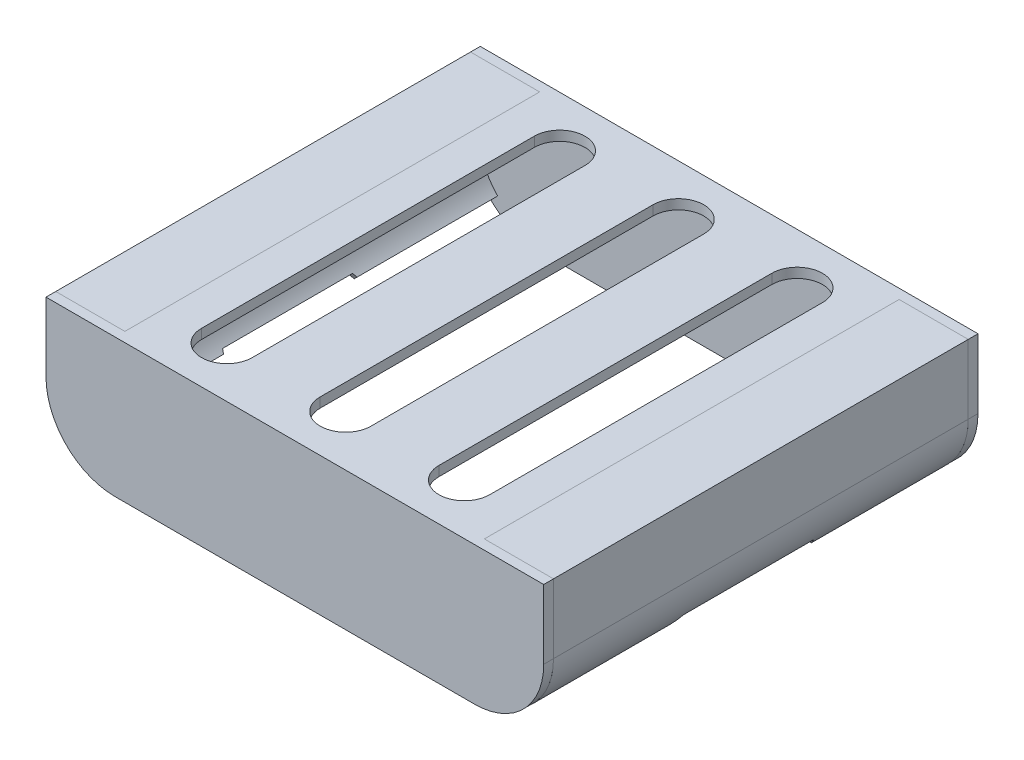
from build123d import *

# Parameters (mm, degrees)
BOSS_EXTRUDE1_START     = -54.757068412
BOSS_EXTRUDE1_OUTLINE_W = 56.134
BOSS_EXTRUDE1_OUTLINE_H = 1.524
BOSS_EXTRUDE1_DEPTH     = 63.5
BOSS_EXTRUDE1_START_2   = -3.957068512
BOSS_EXTRUDE1_2_DEPTH   = 12.7000001
BOSS_EXTRUDE1_3_DEPTH   = 12.7
BOSS_EXTRUDE1_START_3   = 4
BOSS_EXTRUDE1_4_DEPTH   = 8
BOSS_EXTRUDE2_START     = 0.635
BOSS_EXTRUDE2_DEPTH     = 0.635
BOSS_EXTRUDE3_START     = 1.524
BOSS_EXTRUDE3_DEPTH     = 1.524
CUT_EXTRUDE1_DEPTH      = 20.32
BOSS_EXTRUDE4_DEPTH     = 0.635
BOSS_EXTRUDE5_DEPTH     = 1.524
CUT_EXTRUDE2_DEPTH      = 97.141013189
CUT_EXTRUDE3_DEPTH      = 97.141013189
CUT_EXTRUDE4_DEPTH      = 97.470607757
DRAFT1_ANGLE            = 30
BOSS_EXTRUDE10_DEPTH    = 64.77
BOSS_EXTRUDE10_2_DEPTH  = 64.77
CUT_EXTRUDE6_DEPTH      = 95.655903969
CUT_EXTRUDE6_DEPTH_BACK = 95.655903969


with BuildPart() as part:
    # Boss-Extrude1: read off the stored shape, not the designer's step
    # Boss-Extrude1 outline → Boss-Extrude1 (new body)
    with BuildSketch(Plane.XY.offset(-9.377931588).offset(BOSS_EXTRUDE1_START)):
        with BuildLine():
            Line((9.525, 0.127), (11.049, 0.127))
            ThreePointArc((11.049, 0.127), (10.305871492, 4.062975673), (8.178799999, 7.457045699))
            Line((8.178799999, 7.457045699), (8.1788, 4.93833931))
            ThreePointArc((8.1788, 4.93833931), (9.182109033, 2.625061268), (9.525, 0.127))
        make_face()
        with Locations((-27.813, 10.16)):
            Rectangle(BOSS_EXTRUDE1_OUTLINE_W, BOSS_EXTRUDE1_OUTLINE_H)
        with BuildLine():
            Line((-63.8048, 4.93833931), (-63.8048, 7.4570457))
            ThreePointArc((-63.8048, 7.4570457), (-65.931871492, 4.062975673), (-66.675, 0.127))
            Line((-66.675, 0.127), (-65.151, 0.127))
            ThreePointArc((-65.151, 0.127), (-64.808109033, 2.625061268), (-63.8048, 4.93833931))
        make_face()
    extrude(amount=BOSS_EXTRUDE1_DEPTH)

    # Boss-Extrude1 2 outline → Boss-Extrude1 2 (add)
    with BuildSketch(Plane.XY.offset(-9.377931588).offset(BOSS_EXTRUDE1_START_2)):
        with BuildLine():
            Line((8.1788, 4.93833931), (8.178799999, 7.457045699))
            ThreePointArc((8.178799999, 7.457045699), (4.578589667, 10.017902345), (0.253996203, 10.922))
            Line((0.253996203, 10.922), (0.253997015, 9.398))
            ThreePointArc((0.253997015, 9.398), (4.800729077, 8.206523235), (8.1788, 4.93833931))
        make_face()
        with BuildLine():
            Line((-55.879996083, 9.398), (-55.87999707, 10.922))
            ThreePointArc((-55.87999707, 10.922), (-60.204590064, 10.017902172), (-63.8048, 7.4570457))
            Line((-63.8048, 7.4570457), (-63.8048, 4.93833931))
            ThreePointArc((-63.8048, 4.93833931), (-60.426728671, 8.206523463), (-55.879996083, 9.398))
        make_face()
    extrude(amount=BOSS_EXTRUDE1_2_DEPTH)

    # Boss-Extrude1 3 outline → Boss-Extrude1 3 (add)
    with BuildSketch(Plane.XY.offset(-9.377931588).offset(BOSS_EXTRUDE1_START)):
        with BuildLine():
            Line((8.1788, 4.93833931), (8.178799999, 7.457045699))
            ThreePointArc((8.178799999, 7.457045699), (4.578589667, 10.017902345), (0.253996203, 10.922))
            Line((0.253996203, 10.922), (0.253997015, 9.398))
            ThreePointArc((0.253997015, 9.398), (4.800729077, 8.206523235), (8.1788, 4.93833931))
        make_face()
        with BuildLine():
            Line((-55.879996083, 9.398), (-55.87999707, 10.922))
            ThreePointArc((-55.87999707, 10.922), (-60.204590064, 10.017902172), (-63.8048, 7.4570457))
            Line((-63.8048, 7.4570457), (-63.8048, 4.93833931))
            ThreePointArc((-63.8048, 4.93833931), (-60.426728671, 8.206523463), (-55.879996083, 9.398))
        make_face()
    extrude(amount=BOSS_EXTRUDE1_3_DEPTH)

    # Boss-Extrude1 4 outline → Boss-Extrude1 4 (cut)
    with BuildSketch(Plane(origin=(0, 0, 0), x_dir=(1, 0, 0), z_dir=(0, 1, 0)).offset(BOSS_EXTRUDE1_START_3)):
        with BuildLine():
            Line((4.010916814, 9.377931588), (4.421879489, 9.377931396))
            ThreePointArc((4.421879489, 9.377931396), (7.089969704, 10.606775135), (8.1788, 13.335))
            Line((8.1788, 13.335), (0.254, 13.335))
            ThreePointArc((0.254, 13.335), (1.342829022, 10.606776477), (4.010916814, 9.377931588))
        make_face()
        with BuildLine():
            Line((-60.047883129, 9.377931585), (-59.636916814, 9.377931588))
            ThreePointArc((-59.636916814, 9.377931588), (-56.968829022, 10.606776477), (-55.88, 13.335))
            Line((-55.88, 13.335), (-63.8048, 13.335))
            ThreePointArc((-63.8048, 13.335), (-62.715970959, 10.606776456), (-60.047883129, 9.377931585))
        make_face()
        with BuildLine():
            Line((0.254, 51.435), (8.1788, 51.435))
            ThreePointArc((8.1788, 51.435), (4.2164, 55.3974), (0.254, 51.435))
        make_face()
        with BuildLine():
            Line((-63.8048, 51.435), (-55.88, 51.435))
            ThreePointArc((-55.88, 51.435), (-59.8424, 55.3974), (-63.8048, 51.435))
        make_face()
    extrude(amount=BOSS_EXTRUDE1_4_DEPTH, mode=Mode.SUBTRACT)

    # Sketch2 → Boss-Extrude2 (add)
    with BuildSketch(Plane(origin=(0, 0, -64.135), x_dir=(-1, 0, 0), z_dir=(0, 0, -1)).offset(BOSS_EXTRUDE2_START)):
        with BuildLine():
            Line((-0.254, 10.922), (55.88, 10.922))
            ThreePointArc((55.88, 10.922), (59.875408752, 10.155396377), (63.303352044, 7.964465753))
            ThreePointArc((63.303352044, 7.964465753), (63.779199771, 6.836644565), (63.27193426, 5.722600852))
            ThreePointArc((63.27193426, 5.722600852), (60.007627981, 8.428453382), (55.88, 9.398))
            Line((55.88, 9.398), (-0.254, 9.398))
            ThreePointArc((-0.254, 9.398), (-4.381627981, 8.428453382), (-7.64593426, 5.722600852))
            ThreePointArc((-7.64593426, 5.722600852), (-8.153199771, 6.836644565), (-7.677352044, 7.964465753))
            ThreePointArc((-7.677352044, 7.964465753), (-4.249408752, 10.155396377), (-0.254, 10.922))
        make_face()
    extrude(amount=-BOSS_EXTRUDE2_DEPTH)

    # Sketch3 → Boss-Extrude3 (add)
    with BuildSketch(Plane(origin=(0, 0, -64.77), x_dir=(-1, 0, 0), z_dir=(0, 0, -1)).offset(BOSS_EXTRUDE3_START)):
        with BuildLine():
            Line((-0.254, 10.922), (55.88, 10.922))
            Line((55.88, 10.922), (66.675, 10.922))
            Line((66.675, 10.922), (66.675, 0.127))
            ThreePointArc((66.675, 0.127), (63.513217703, -7.506217703), (55.88, -10.668))
            Line((55.88, -10.668), (-0.254, -10.668))
            ThreePointArc((-0.254, -10.668), (-7.887217703, -7.506217703), (-11.049, 0.127))
            Line((-11.049, 0.127), (-11.049, 10.922))
            Line((-11.049, 10.922), (-0.254, 10.922))
        make_face()
    extrude(amount=-BOSS_EXTRUDE3_DEPTH)

    # Sketch4 → Cut-Extrude1 (cut)
    with BuildSketch(Plane(origin=(0, 0, -42.545), x_dir=(-1, 0, 0), z_dir=(0, 0, -1))):
        with BuildLine():
            Line((-9.398881902, 1.651), (-10.940882099, 1.651))
            ThreePointArc((-10.940882099, 1.651), (-11.0219366, 0.890915159), (-11.049, 0.127))
            Line((-11.049, 0.127), (-9.525, 0.127))
            ThreePointArc((-9.525, 0.127), (-9.493416678, 0.891604763), (-9.398881902, 1.651))
        make_face()
    extrude(amount=-CUT_EXTRUDE1_DEPTH, mode=Mode.SUBTRACT)

    # Sketch5 → Boss-Extrude4 (add)
    with BuildSketch(Plane.XY.offset(-0.635)):
        with BuildLine():
            Line((0.254, 9.398), (-55.88, 9.398))
            ThreePointArc((-55.88, 9.398), (-60.007627981, 8.428453382), (-63.27193426, 5.722600852))
            ThreePointArc((-63.27193426, 5.722600852), (-63.779199771, 6.836644565), (-63.303352044, 7.964465753))
            ThreePointArc((-63.303352044, 7.964465753), (-59.875408752, 10.155396377), (-55.88, 10.922))
            Line((-55.88, 10.922), (0.254, 10.922))
            ThreePointArc((0.254, 10.922), (4.249408752, 10.155396377), (7.677352044, 7.964465753))
            ThreePointArc((7.677352044, 7.964465753), (8.153199771, 6.836644565), (7.64593426, 5.722600852))
            ThreePointArc((7.64593426, 5.722600852), (4.381627981, 8.428453382), (0.254, 9.398))
        make_face()
    extrude(amount=BOSS_EXTRUDE4_DEPTH)

    # Sketch6 → Boss-Extrude5 (add)
    with BuildSketch(Plane.XY):
        with BuildLine():
            Line((-55.88, 10.922), (0.254, 10.922))
            Line((0.254, 10.922), (11.049, 10.922))
            Line((11.049, 10.922), (11.049, 0.127))
            ThreePointArc((11.049, 0.127), (7.887217703, -7.506217703), (0.254, -10.668))
            Line((0.254, -10.668), (-55.88, -10.668))
            ThreePointArc((-55.88, -10.668), (-63.513217703, -7.506217703), (-66.675, 0.127))
            Line((-66.675, 0.127), (-66.675, 10.922))
            Line((-66.675, 10.922), (-55.88, 10.922))
        make_face()
    extrude(amount=BOSS_EXTRUDE5_DEPTH)

    # Sketch8 → Cut-Extrude2 (cut, through all)
    with BuildSketch(Plane.XZ.offset(-9.398)):
        with BuildLine():
            Line((-5.3086, -58.3692), (-5.3086, -6.4008))
            ThreePointArc((-5.3086, -6.4008), (-9.271, -2.4384), (-13.2334, -6.4008))
            Line((-13.2334, -6.4008), (-13.2334, -58.3692))
            ThreePointArc((-13.2334, -58.3692), (-9.271, -62.3316), (-5.3086, -58.3692))
        make_face()
    extrude(amount=-CUT_EXTRUDE2_DEPTH, mode=Mode.SUBTRACT)

    # Sketch9 → Cut-Extrude3 (cut, through all)
    with BuildSketch(Plane.XZ.offset(-9.398)):
        with BuildLine():
            Line((-42.3926, -58.3692), (-42.3926, -6.4008))
            ThreePointArc((-42.3926, -6.4008), (-46.355, -2.4384), (-50.3174, -6.4008))
            Line((-50.3174, -6.4008), (-50.3174, -58.3692))
            ThreePointArc((-50.3174, -58.3692), (-46.355, -62.3316), (-42.3926, -58.3692))
        make_face()
    extrude(amount=-CUT_EXTRUDE3_DEPTH, mode=Mode.SUBTRACT)

    # Sketch10 → Cut-Extrude4 (cut, through all)
    with BuildSketch(Plane(origin=(0, 10.922, 0), x_dir=(-1, 0, 0), z_dir=(0, 1, 0))):
        with BuildLine():
            Line((31.7754, -58.3692), (31.7754, -6.4008))
            ThreePointArc((31.7754, -6.4008), (27.813, -2.4384), (23.8506, -6.4008))
            Line((23.8506, -6.4008), (23.8506, -58.3692))
            ThreePointArc((23.8506, -58.3692), (27.813, -62.3316), (31.7754, -58.3692))
        make_face()
    extrude(amount=-CUT_EXTRUDE4_DEPTH, mode=Mode.SUBTRACT)

    # Draft1
    draft1_faces = [part.faces().sort_by_distance(p)[0] for p in [
        (10.247932379, 0.89048884, -22.225),
        (10.247932379, 0.89048884, -42.545),
    ]]
    draft(draft1_faces, Plane(origin=(9.398881902, 1.651, -22.225), x_dir=(0, 0, -1), z_dir=(0, -1, 0)), DRAFT1_ANGLE)


with BuildPart() as body_2:
    # Sketch15 → Boss-Extrude10 (new body)
    with BuildSketch(Plane.XY.offset(-64.77)):
        with BuildLine():
            Line((-63.513217703, -7.506217703), (-62.435586968, -6.428586968))
            ThreePointArc((-62.435586968, -6.428586968), (-65.129117713, -0.509602336), (-63.27193426, 5.722600852))
            ThreePointArc((-63.27193426, 5.722600852), (-63.779199771, 6.836644565), (-63.303352044, 7.964465753))
            ThreePointArc((-63.303352044, 7.964465753), (-59.875408752, 10.155396377), (-55.88, 10.922))
            Line((-55.88, 10.922), (-66.675, 10.922))
            Line((-66.675, 10.922), (-66.675, 0.127))
            ThreePointArc((-66.675, 0.127), (-65.853279553, -4.004067652), (-63.513217703, -7.506217703))
        make_face()
    extrude(amount=BOSS_EXTRUDE10_DEPTH)


with BuildPart() as body_3:
    # Sketch15 → Boss-Extrude10 2 (new body)
    with BuildSketch(Plane.XY.offset(-64.77)):
        with BuildLine():
            Line((6.809586968, -6.428586968), (7.887217703, -7.506217703))
            ThreePointArc((7.887217703, -7.506217703), (10.227279553, -4.004067652), (11.049, 0.127))
            Line((11.049, 0.127), (11.049, 10.922))
            Line((11.049, 10.922), (0.254, 10.922))
            ThreePointArc((0.254, 10.922), (4.249408752, 10.155396377), (7.677352044, 7.964465753))
            ThreePointArc((7.677352044, 7.964465753), (8.153199771, 6.836644565), (7.64593426, 5.722600852))
            ThreePointArc((7.64593426, 5.722600852), (9.503117713, -0.509602336), (6.809586968, -6.428586968))
        make_face()
    extrude(amount=BOSS_EXTRUDE10_2_DEPTH)


with BuildPart() as cut_extrude6_tool:
    # Sketch16 → Cut-Extrude6 (new, two sides: drawn at the far end of the back side and taken through both)
    with BuildSketch(Plane(origin=(0, 0, 0), x_dir=(0, 0, -1), z_dir=(1, 0, 0)).offset(-CUT_EXTRUDE6_DEPTH_BACK)):
        Polygon((21.34627289, -7.506217703), (43.42372711, -7.506217703), (42.545, -5.984217703), (22.225, -5.984217703), align=None)
    extrude(amount=CUT_EXTRUDE6_DEPTH + CUT_EXTRUDE6_DEPTH_BACK)


with BuildPart() as body_2_1:
    add(body_2.part)

    # Cut-Extrude6: cut by cut_extrude6_tool
    add(cut_extrude6_tool.part, mode=Mode.SUBTRACT)


with BuildPart() as body_3_1:
    add(body_3.part)

    # Cut-Extrude6: cut by cut_extrude6_tool
    add(cut_extrude6_tool.part, mode=Mode.SUBTRACT)


solid = Compound([part.part, body_2_1.part, body_3_1.part])
